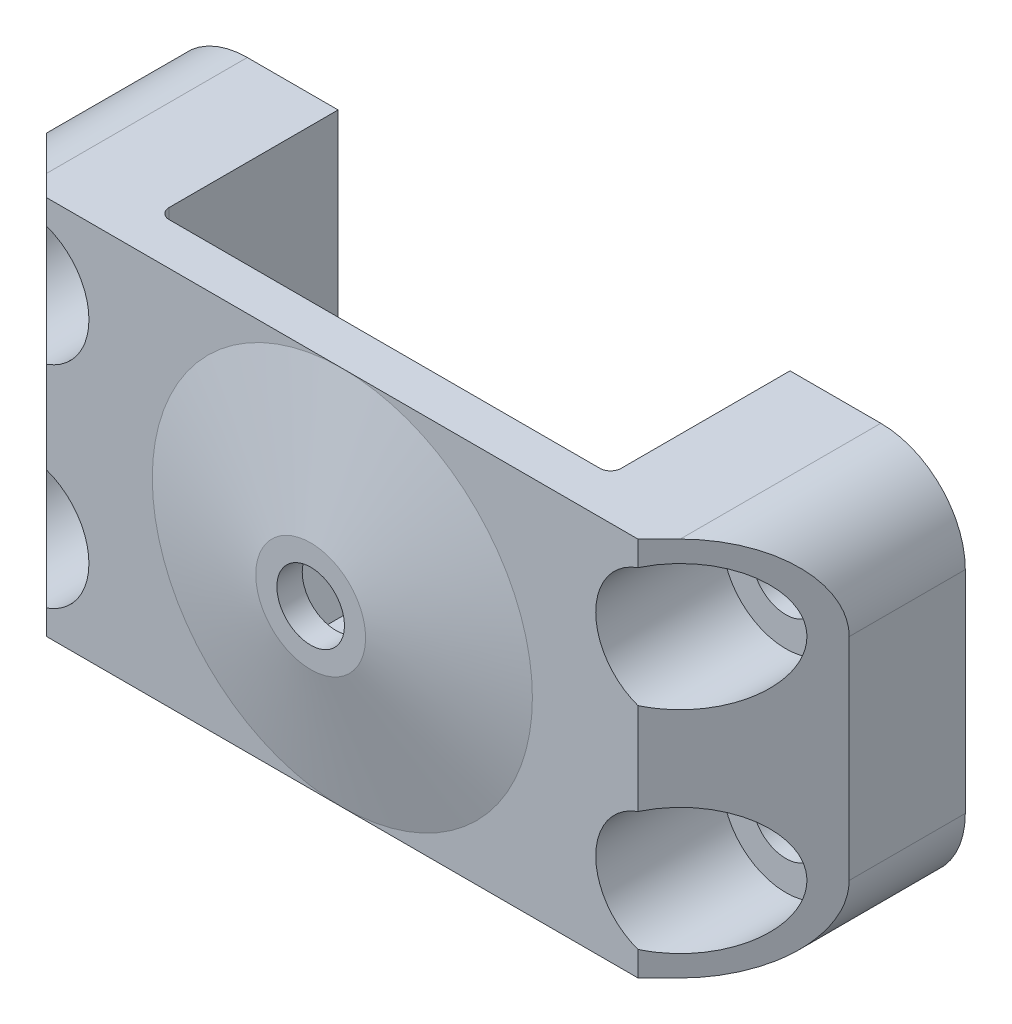
from build123d import *
from build123d.topology import SkipClean

# Parameters (mm, degrees)
BOSS_EXTRUDE1_DEPTH     = 9
SKETCH2_R               = 1.6
CUT_EXTRUDE1_DEPTH      = 24.5
SKETCH3_R               = 1.6
CUT_EXTRUDE2_DEPTH      = 23.677080941
CUT_EXTRUDE3_DEPTH      = 2.3
CUT_EXTRUDE4_DEPTH      = 24.5
CUT_EXTRUDE4_DEPTH_BACK = 24.5
FILLET2_R               = 4
FILLET5_R               = 0.5
SKETCH11_R              = 3
CUT_EXTRUDE5_DEPTH      = 6


with BuildPart() as part:
    # Sketch1 → Boss-Extrude1 (new, symmetric)
    with BuildSketch(Plane(origin=(0, 0, 0), x_dir=(1, 0, 0), z_dir=(0, 1, 0))):
        Polygon((10.7, 10.5), (19, 10.5), (19, 0), (-19, 0), (-19, 10.5), (-10.7, 10.5), (-10.7, 2), (10.7, 2), align=None)
    extrude(amount=BOSS_EXTRUDE1_DEPTH, both=True)

    # Sketch2 → Cut-Extrude1 (cut, through all)
    with BuildSketch(Plane(origin=(0, 0, -10.5), x_dir=(-1, 0, 0), z_dir=(0, 0, -1))):
        with Locations((-15, 5)):
            Circle(SKETCH2_R)
        with Locations((-15, -5)):
            Circle(SKETCH2_R)
        with Locations((15, 5)):
            Circle(SKETCH2_R)
        with Locations((15, -5)):
            Circle(SKETCH2_R)
    extrude(amount=-CUT_EXTRUDE1_DEPTH, mode=Mode.SUBTRACT)

    # Sketch3 → Cut-Extrude2 (cut, through all)
    with BuildSketch(Plane(origin=(0, 0, -2), x_dir=(-1, 0, 0), z_dir=(0, 0, -1))):
        Circle(SKETCH3_R)
    extrude(amount=-CUT_EXTRUDE2_DEPTH, mode=Mode.SUBTRACT)

    # Sketch9 → Revolve1 (revolve)
    with SkipClean():  # the faces are left unmerged after this step: merging them gives an invalid solid
        with BuildSketch(Plane(origin=(0, 0, 0), x_dir=(0, 0, -1), z_dir=(1, 0, 0))):
            Polygon((0, 1.6), (0, 9), (-1.5, 2.6), (-1.5, 1.6), align=None)
        revolve(axis=Axis((0, 0, 0), (0, 0, 1)))

    # Sketch4 → Cut-Extrude3 (cut)
    with BuildSketch(Plane(origin=(0, 0, -2), x_dir=(-1, 0, 0), z_dir=(0, 0, -1))):
        Polygon((1.602042514, 2.808343483), (-1.631075541, 2.791581257), (-3.233118056, -0.016762226), (-1.602042514, -2.808343483), (1.631075541, -2.791581257), (3.233118056, 0.016762226), align=None)
    extrude(amount=-CUT_EXTRUDE3_DEPTH, mode=Mode.SUBTRACT)

    # Sketch10 → Cut-Extrude4 (cut, two sides: drawn at the far end of the back side and taken through both)
    with BuildSketch(Plane(origin=(0, 0, 0), x_dir=(1, 0, 0), z_dir=(0, 1, 0)).offset(-CUT_EXTRUDE4_DEPTH_BACK)):
        Polygon((-19, 0), (-19, 5), (-14, 0), align=None)
        Polygon((14, 0), (19, 0), (19, 5), align=None)
    extrude(amount=CUT_EXTRUDE4_DEPTH + CUT_EXTRUDE4_DEPTH_BACK, mode=Mode.SUBTRACT)

    # Fillet2
    fillet2_edges = [part.edges().sort_by_distance(p)[0] for p in [
        (19, -9, -7.75),
        (19, 9, -7.75),
        (-19, -9, -7.75),
        (-19, 9, -7.75),
    ]]
    fillet(fillet2_edges, radius=FILLET2_R)

    # Fillet5
    fillet5_edges = [part.edges().sort_by_distance(p)[0] for p in [
        (-10.7, 0, -2),
        (10.7, 0, -2),
    ]]
    fillet(fillet5_edges, radius=FILLET5_R)

    # Sketch11 → Cut-Extrude5 (cut)
    with BuildSketch(Plane.XY):
        with Locations((-15, 5)):
            Circle(SKETCH11_R)
        with Locations((-15, -5)):
            Circle(SKETCH11_R)
        with Locations((15, 5)):
            Circle(SKETCH11_R)
        with Locations((15, -5)):
            Circle(SKETCH11_R)
    extrude(amount=-CUT_EXTRUDE5_DEPTH, mode=Mode.SUBTRACT)


solid = part.part
